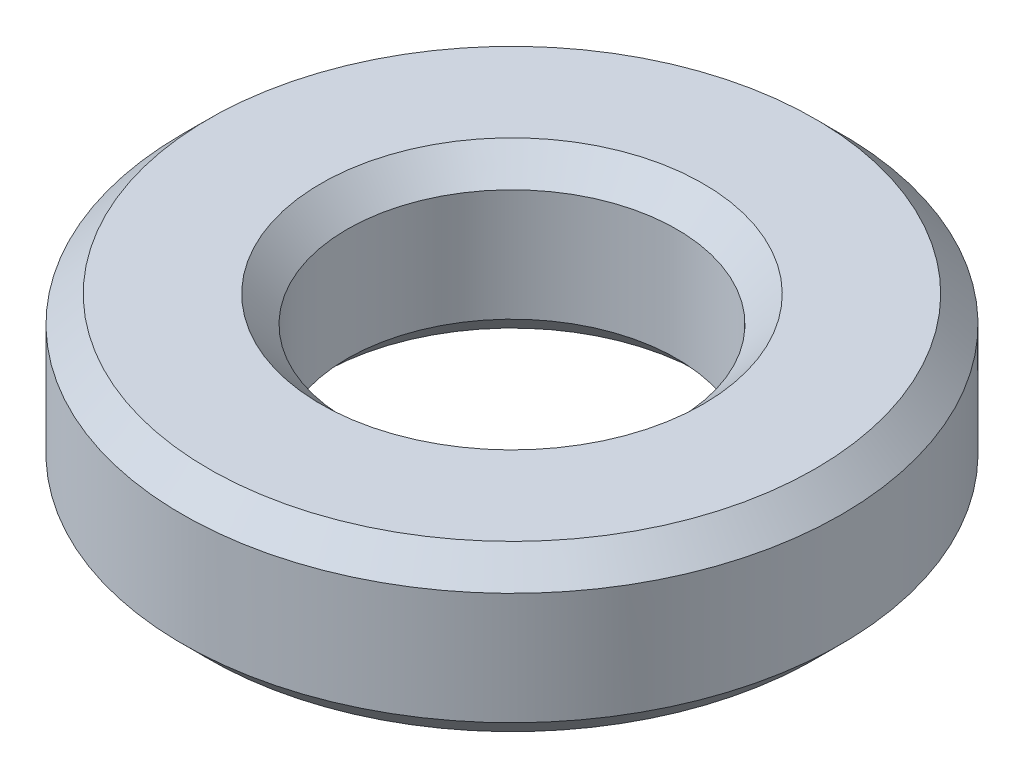
from build123d import *

# Parameters (mm, degrees)
SKETCH1_W     = 1.5875
SKETCH1_H     = 1.5875
CHAMFER1_SIZE = 0.254


with BuildPart() as part:
    # Sketch1 → Revolve1 (revolve)
    with BuildSketch(Plane.XY):
        with Locations((2.38125, 0)):
            Rectangle(SKETCH1_W, SKETCH1_H)
    revolve(axis=Axis((0, 1.644566993, 0), (0, -1, 0)))

    # Chamfer1
    chamfer1_edges = [part.edges().sort_by_distance(p)[0] for p in [
        (-3.175, -0.79375, 0),
        (-3.175, 0.79375, 0),
        (-1.5875, 0.79375, 0),
        (-1.5875, -0.79375, 0),
    ]]
    chamfer(chamfer1_edges, length=CHAMFER1_SIZE)


solid = part.part
